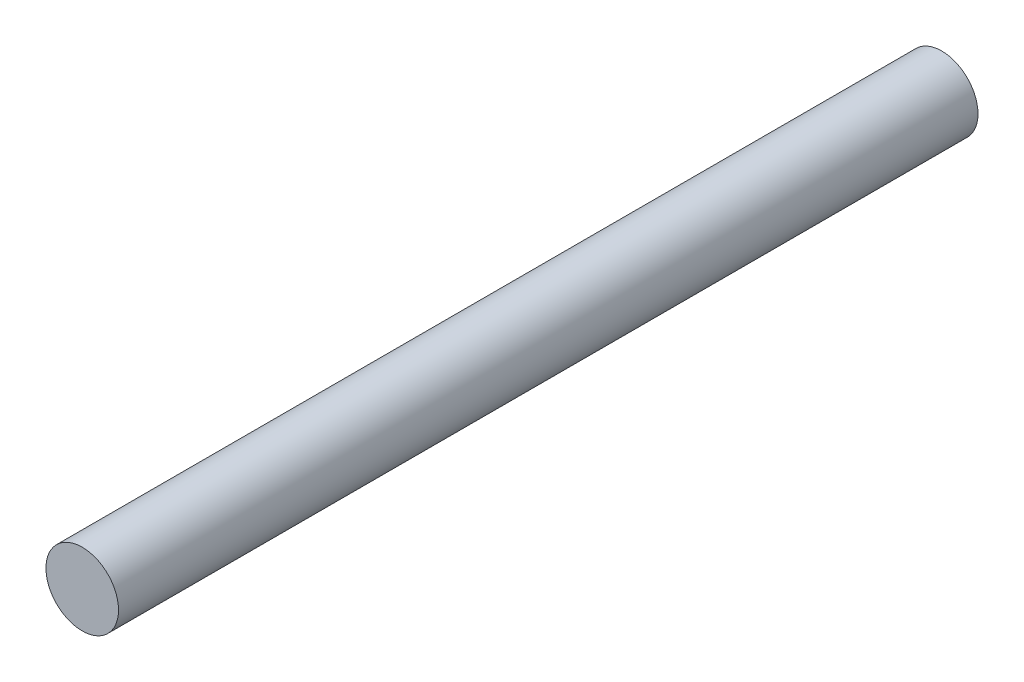
from build123d import *

# Parameters (mm, degrees)
SKETCH2_R           = 7.9375
BOSS_EXTRUDE1_DEPTH = 187.96


with BuildPart() as part:
    # Sketch2 → Boss-Extrude1 (new body)
    with BuildSketch(Plane.XY):
        Circle(SKETCH2_R)
    extrude(amount=BOSS_EXTRUDE1_DEPTH)


solid = part.part
